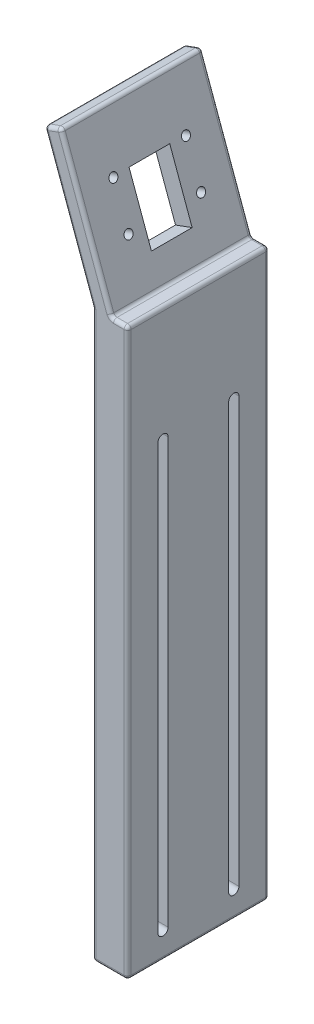
from build123d import *

# Parameters (mm, degrees)
BOSS_EXTRU_1_DEPTH       = 40
D_GAGEMENT_START         = 54.723222932
D_GAGEMENT_M22_OUTLINE_R = 1.2
D_GAGEMENT_M22_DEPTH     = 5
ENL_V_MAT_EXTRU_3_REACH  = 166.408
ESQUISSE12_W             = 11.5
ESQUISSE12_H             = 18.5
CONG_2_R                 = 1
ENL_V_MAT_EXTRU_4_REACH  = 205.438


# Read off the part's stored shape, not the designer's step: Dégagement M22
with BuildPart() as part:
    # Esquisse1 → Boss.-Extru.1 (new body)
    with BuildSketch(Plane.XY):
        Polygon((0, 0), (10, 0), (10, 160), (5.320888862, 160), (-8.982342629, 199.297805548), (-13.680805733, 197.587704831), (0, 160), align=None)
    extrude(amount=BOSS_EXTRU_1_DEPTH)

    # Dégagement M22 outline → Dégagement M22 (cut)
    with BuildSketch(Plane(origin=(0, 0, 0), x_dir=(-0.3420201433256691, 0.9396926207859082, 0), z_dir=(0.9396926207859083, 0.3420201433256691, 0)).offset(D_GAGEMENT_START)):
        with Locations((162.600819326, 30.25)):
            Circle(D_GAGEMENT_M22_OUTLINE_R)
        with Locations((175.100819326, 9.75)):
            Circle(D_GAGEMENT_M22_OUTLINE_R)
        with Locations((175.100819326, 30.25)):
            Circle(D_GAGEMENT_M22_OUTLINE_R)
        with Locations((162.600819326, 9.75)):
            Circle(D_GAGEMENT_M22_OUTLINE_R)
    extrude(amount=D_GAGEMENT_M22_DEPTH, mode=Mode.SUBTRACT)

    # Esquisse12 → Enlèv. mat.-Extru.3 (cut, up to next)
    with BuildSketch(Plane(origin=(39.231681983, 52.211839625, 50.949763499), x_dir=(0, 0, 1), z_dir=(-0.9396926207859084, -0.3420201433256691, 0)), mode=Mode.PRIVATE) as enl_v_mat_extru_3_sk1:
        with Locations((-30.949763499, 130.455764407)):
            Rectangle(ESQUISSE12_W, ESQUISSE12_H)
    enl_v_mat_extru_3_tool1 = extrude(enl_v_mat_extru_3_sk1.sketch, amount=-ENL_V_MAT_EXTRU_3_REACH, mode=Mode.PRIVATE) & part.part
    add(enl_v_mat_extru_3_tool1.solids().sort_by_distance((-5.386817, 174.800159, 20))[0], mode=Mode.SUBTRACT)

    # Congé2
    cong_2_edges = [part.edges().sort_by_distance(p)[0] for p in [
        (0, 80, 0),
        (0, 160, 20),
        (-13.680805733, 197.587704831, 20),
        (-8.982342629, 199.297805548, 20),
        (10, 80, 40),
        (5.320888862, 160, 20),
        (10, 160, 20),
        (10, 0, 20),
        (0, 0, 20),
        (7.660444431, 160, 40),
        (-1.830726883, 179.648902774, 40),
        (-11.331574181, 198.44275519, 40),
        (-6.840402867, 178.793852416, 40),
        (0, 80, 40),
        (-6.840402867, 178.793852416, 0),
        (-11.331574181, 198.44275519, 0),
        (-1.830726883, 179.648902774, 0),
        (7.660444431, 160, 0),
        (5, 0, 40),
        (10, 80, 0),
        (5, 0, 0),
    ]]
    fillet(cong_2_edges, radius=CONG_2_R)

    # Esquisse13 → Enlèv. mat.-Extru.4 (cut, up to next)
    with BuildSketch(Plane.ZY, mode=Mode.PRIVATE) as enl_v_mat_extru_4_sk1:
        with BuildLine():
            Line((8.55, 7.5), (8.55, 127.5))
            ThreePointArc((8.55, 127.5), (10, 128.95), (11.45, 127.5))
            Line((11.45, 127.5), (11.45, 7.5))
            ThreePointArc((11.45, 7.5), (10, 6.05), (8.55, 7.5))
        make_face()
    enl_v_mat_extru_4_tool1 = extrude(enl_v_mat_extru_4_sk1.sketch, amount=-ENL_V_MAT_EXTRU_4_REACH, mode=Mode.PRIVATE) & part.part
    # Esquisse13 → Enlèv. mat.-Extru.4 (cut, up to next)
    with BuildSketch(Plane.ZY, mode=Mode.PRIVATE) as enl_v_mat_extru_4_sk2:
        with BuildLine():
            Line((28.55, 7.5), (28.55, 127.5))
            ThreePointArc((28.55, 127.5), (30, 128.95), (31.45, 127.5))
            Line((31.45, 127.5), (31.45, 7.5))
            ThreePointArc((31.45, 7.5), (30, 6.05), (28.55, 7.5))
        make_face()
    enl_v_mat_extru_4_tool2 = extrude(enl_v_mat_extru_4_sk2.sketch, amount=-ENL_V_MAT_EXTRU_4_REACH, mode=Mode.PRIVATE) & part.part
    add(enl_v_mat_extru_4_tool1.solids().sort_by_distance((0, 67.5, 10))[0], mode=Mode.SUBTRACT)
    add(enl_v_mat_extru_4_tool2.solids().sort_by_distance((0, 67.5, 30))[0], mode=Mode.SUBTRACT)


solid = part.part
